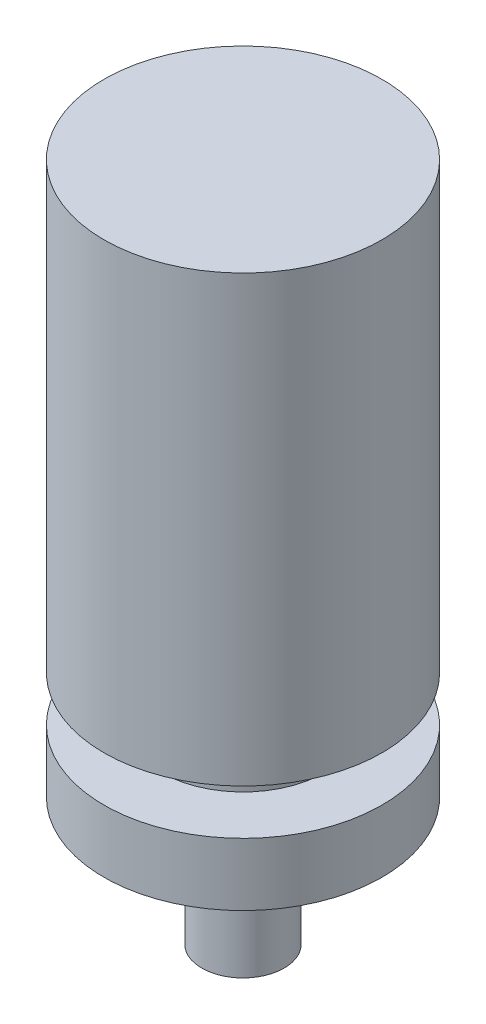
from build123d import *

# Parameters (mm, degrees)
SKETCH1_R           = 16.891
EXTRUDE1_DEPTH      = 7.6
SKETCH2_R           = 9.998276061
EXTRUDE2_DEPTH      = 5.5
SKETCH3_R           = 16.891
EXTRUDE3_DEPTH      = 53.975
SKETCH4_R           = 5.5
BOSS_EXTRUDE1_DEPTH = 15.5
CUT_EXTRUDE1_START  = -9
SKETCH5_R           = 5.5
SKETCH5_R_2         = 5
CUT_EXTRUDE1_DEPTH  = 9


with BuildPart() as part:
    # Sketch1 → Extrude1 (new body)
    with BuildSketch(Plane(origin=(0, 0, 0), x_dir=(1, 0, 0), z_dir=(0, 1, 0))):
        Circle(SKETCH1_R)
    extrude(amount=EXTRUDE1_DEPTH)

    # Sketch2 → Extrude2 (add)
    with BuildSketch(Plane(origin=(0, 7.6, 0), x_dir=(1, 0, 0), z_dir=(0, 1, 0))):
        Circle(SKETCH2_R)
    extrude(amount=EXTRUDE2_DEPTH)

    # Sketch3 → Extrude3 (add)
    with BuildSketch(Plane(origin=(0, 13.1, 0), x_dir=(1, 0, 0), z_dir=(0, 1, 0))):
        Circle(SKETCH3_R)
    extrude(amount=EXTRUDE3_DEPTH)

    # Sketch4 → Boss-Extrude1 (add)
    with BuildSketch(Plane.XZ):
        Circle(SKETCH4_R)
    extrude(amount=BOSS_EXTRUDE1_DEPTH)

    # Sketch5 → Cut-Extrude1 (cut)
    with BuildSketch(Plane.XZ.offset(15.5).offset(CUT_EXTRUDE1_START)):
        Circle(SKETCH5_R)
        Circle(SKETCH5_R_2, mode=Mode.SUBTRACT)
    extrude(amount=CUT_EXTRUDE1_DEPTH, mode=Mode.SUBTRACT)


solid = part.part
